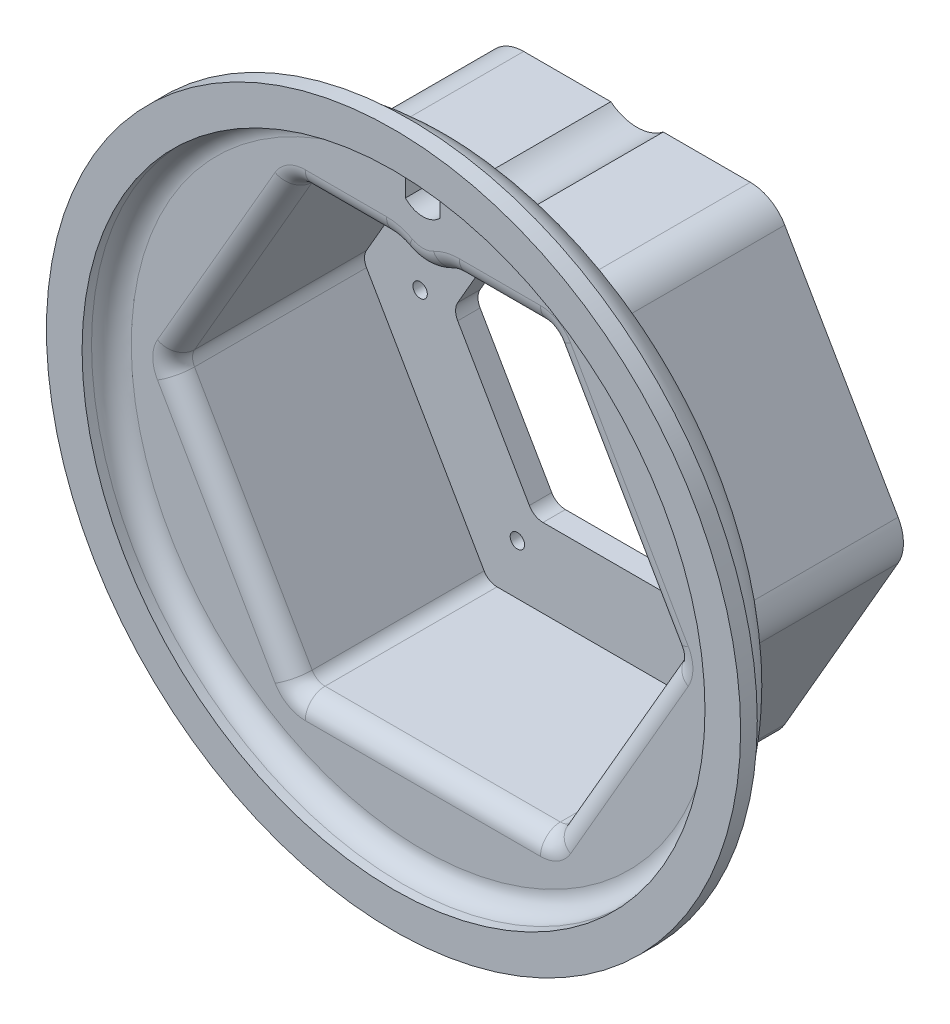
from build123d import *

# Parameters (mm, degrees)
BOSS_EXTRUDE1_DEPTH = 65
BOSS_EXTRUDE2_START = 9
BOSS_EXTRUDE2_DEPTH = 9
SKETCH6_R           = 132.3
BOSS_EXTRUDE3_DEPTH = 12.2
CUT_EXTRUDE1_REACH  = 204.402
SKETCH3_R           = 2.9
FILLET1_R           = 6.35
FILLET2_R           = 6
FILLET3_R           = 14
FILLET6_R           = 14
SKETCH12_R          = 131.85493252
SKETCH12_R_2        = 125.35493252
BOSS_EXTRUDE5_DEPTH = 5.1
SKETCH13_R          = 139.7
SKETCH13_R_2        = 125.35493252
BOSS_EXTRUDE7_DEPTH = 6.7
FILLET7_R           = 8
FILLET8_R           = 4
FILLET9_R           = 8
CUT_EXTRUDE2_DEPTH  = 211.969618666
CIRPATTERN1_COUNT   = 6
FILLET11_R          = 16
FILLET10_R          = 4


with BuildPart() as part:
    # Sketch1 → Boss-Extrude1 (new body)
    with BuildSketch(Plane.XY):
        with BuildLine():
            Line((109.696551146, 0), (54.848275573, 95))
            Line((54.848275573, 95), (10.560528181, 95))
            ThreePointArc((10.560528181, 95), (0, 91.321983506), (-10.560528181, 95))
            Line((-10.560528181, 95), (-54.848275573, 95))
            Line((-54.848275573, 95), (-109.696551146, 0))
            Line((-109.696551146, 0), (-54.848275573, -95))
            Line((-54.848275573, -95), (54.848275573, -95))
            Line((54.848275573, -95), (109.696551146, 0))
        make_face()
        with BuildLine():
            Line((101.613647377, 0), (50.806823689, 88))
            Line((50.806823689, 88), (10.560528181, 88))
            ThreePointArc((10.560528181, 88), (0, 84.321983506), (-10.560528181, 88))
            Line((-10.560528181, 88), (-50.806823689, 88))
            Line((-50.806823689, 88), (-101.613647377, 0))
            Line((-101.613647377, 0), (-50.806823689, -88))
            Line((-50.806823689, -88), (50.806823689, -88))
            Line((50.806823689, -88), (101.613647377, 0))
        make_face(mode=Mode.SUBTRACT)
    extrude(amount=BOSS_EXTRUDE1_DEPTH)

    # Sketch2 → Boss-Extrude2 (add)
    with BuildSketch(Plane(origin=(0, 0, 0), x_dir=(-1, 0, 0), z_dir=(0, 0, -1)).offset(BOSS_EXTRUDE2_START)):
        with BuildLine():
            Line((109.696551146, 0), (54.848275573, 95))
            Line((54.848275573, 95), (10.560528181, 95))
            ThreePointArc((10.560528181, 95), (0, 91.321983506), (-10.560528181, 95))
            Line((-10.560528181, 95), (-54.848275573, 95))
            Line((-54.848275573, 95), (-109.696551146, 0))
            Line((-109.696551146, 0), (-54.848275573, -95))
            Line((-54.848275573, -95), (54.848275573, -95))
            Line((54.848275573, -95), (109.696551146, 0))
        make_face()
        Polygon((65, 0), (32.5, 56.291651246), (-32.5, 56.291651246), (-65, 0), (-32.5, -56.291651246), (32.5, -56.291651246), align=None, mode=Mode.SUBTRACT)
    extrude(amount=-BOSS_EXTRUDE2_DEPTH)

    # Sketch6 → Boss-Extrude3 (add)
    with BuildSketch(Plane.XY.offset(65)):
        Circle(SKETCH6_R)
        with BuildLine():
            Line((101.613647377, 0), (50.806823689, 88))
            Line((50.806823689, 88), (10.560528181, 88))
            ThreePointArc((10.560528181, 88), (0, 84.321983506), (-10.560528181, 88))
            Line((-10.560528181, 88), (-50.806823689, 88))
            Line((-50.806823689, 88), (-101.613647377, 0))
            Line((-101.613647377, 0), (-50.806823689, -88))
            Line((-50.806823689, -88), (50.806823689, -88))
            Line((50.806823689, -88), (101.613647377, 0))
        make_face(mode=Mode.SUBTRACT)
    extrude(amount=BOSS_EXTRUDE3_DEPTH)

    # Sketch3 → Cut-Extrude1 (cut, up to next)
    with BuildSketch(Plane.XY, mode=Mode.PRIVATE) as cut_extrude1_sk1:
        with Locations((78.3, 0)):
            Circle(SKETCH3_R)
    cut_extrude1_tool1 = extrude(cut_extrude1_sk1.sketch, amount=-CUT_EXTRUDE1_REACH, mode=Mode.PRIVATE) & part.part
    cut_extrude1 = cut_extrude1_tool1.solids().sort_by_distance((78.3, 0, 0))[0]
    add(cut_extrude1, mode=Mode.SUBTRACT)

    # Fillet1
    fillet1_edges = [part.edges().sort_by_distance(p)[0] for p in [
        (-65, 0, -4.5),
        (-32.5, 56.291651246, -4.5),
        (32.5, 56.291651246, -4.5),
        (65, 0, -4.5),
        (32.5, -56.291651246, -4.5),
        (-32.5, -56.291651246, -4.5),
    ]]
    fillet(fillet1_edges, radius=FILLET1_R)

    # Fillet2
    fillet2_edges = [part.edges().sort_by_distance(p)[0] for p in [
        (50.806823689, -88, 38.6),
        (101.613647377, 0, 38.6),
        (50.806823689, 88, 38.6),
        (-50.806823689, 88, 38.6),
        (-101.613647377, 0, 38.6),
        (-50.806823689, -88, 38.6),
    ]]
    fillet(fillet2_edges, radius=FILLET2_R)

    # Fillet3
    fillet3_edges = [part.edges().sort_by_distance(p)[0] for p in [
        (10.560528181, 88, 38.6),
        (-10.560528181, 88, 38.6),
    ]]
    fillet(fillet3_edges, radius=FILLET3_R)

    # Fillet6
    # the kernel refuses this fillet: 14 mm, written as the material it takes off along each edge
    with BuildSketch(Plane(origin=(0, 0, 65), x_dir=(1, 0, 0), z_dir=(0, -1, 0))) as fillet6_piece_1:
        with BuildLine():
            CenterArc((118.416196487, 14), FILLET6_R, 270, 82.612951564)
            Line((118.416196487, 0), (118.416196487, -0.28))
            Line((118.416196487, -0.28), (132.3, -0.28))
            Line((132.3, -0.28), (132.58, 0))
            ThreePointArc((132.58, 0), (132.58, 6.1), (132.57767607, 12.164))
            Line((132.57767607, 12.164), (132.3, 12.2))
        make_face()
    revolve(axis=Axis((0, 0, 65), (0, 0, 1)), mode=Mode.SUBTRACT)

    # Sketch12 → Boss-Extrude5 (add)
    with BuildSketch(Plane.XY.offset(77.2)):
        Circle(SKETCH12_R)
        Circle(SKETCH12_R_2, mode=Mode.SUBTRACT)
    extrude(amount=BOSS_EXTRUDE5_DEPTH)

    # Sketch13 → Boss-Extrude7 (add)
    with BuildSketch(Plane.XY.offset(82.3)):
        Circle(SKETCH13_R)
        Circle(SKETCH13_R_2, mode=Mode.SUBTRACT)
    extrude(amount=BOSS_EXTRUDE7_DEPTH)

    # Fillet7
    fillet7_edges = [part.edges().sort_by_distance(p)[0] for p in [
        (-125.35493252, 0, 77.2),
    ]]
    fillet(fillet7_edges, radius=FILLET7_R)

    # Fillet8
    fillet8_edges = [part.edges().sort_by_distance(p)[0] for p in [
        (-131.85493252, 0, 82.3),
    ]]
    fillet(fillet8_edges, radius=FILLET8_R)

    # Fillet9
    fillet9_edges = [part.edges().sort_by_distance(p)[0] for p in [
        (-76.210235533, -44, 77.2),
        (0, -88, 77.2),
        (76.210235533, -44, 77.2),
        (76.210235533, 44, 77.2),
        (30.994427629, 88, 77.2),
        (-76.210235533, 44, 77.2),
        (-50.342722074, -87.196152423, 77.2),
        (50.342722074, -87.196152423, 77.2),
        (100.685444147, 0, 77.2),
        (50.342722074, 87.196152423, 77.2),
        (-50.342722074, 87.196152423, 77.2),
        (-100.685444147, 0, 77.2),
        (0, 84.321983506, 77.2),
        (-30.994427629, 88, 77.2),
        (11.236253723, 87.578391733, 77.2),
        (-11.236253723, 87.578391733, 77.2),
    ]]
    fillet(fillet9_edges, radius=FILLET9_R)

    # Sketch9 → Cut-Extrude2 (cut, through all)
    with BuildSketch(Plane(origin=(0, 0, 65), x_dir=(-1, 0, 0), z_dir=(0, 0, -1))):
        with BuildLine():
            Line((7, 106.321983506), (7, 119.321983506))
            ThreePointArc((7, 119.321983506), (0, 122.321983506), (-7, 119.321983506))
            Line((-7, 119.321983506), (-7, 106.321983506))
            ThreePointArc((-7, 106.321983506), (0, 103.321983506), (7, 106.321983506))
        make_face()
    extrude(amount=-CUT_EXTRUDE2_DEPTH, mode=Mode.SUBTRACT)

    # CirPattern1: Cut-Extrude1 ×6 about axis
    cirpattern1_axis = Axis((0, 0, 0), (0, 0, 1))
    for i in range(1, CIRPATTERN1_COUNT):
        add(cut_extrude1.rotate(cirpattern1_axis, i * 360 / CIRPATTERN1_COUNT), mode=Mode.SUBTRACT)

    # Fillet11
    fillet11_edges = [part.edges().sort_by_distance(p)[0] for p in [
        (54.848275573, -95, 28),
        (-54.848275573, -95, 28),
        (-109.696551146, 0, 28),
        (-54.848275573, 95, 28),
        (54.848275573, 95, 28),
        (109.696551146, 0, 28),
    ]]
    fillet(fillet11_edges, radius=FILLET11_R)

    # Fillet10
    fillet10_edges = [part.edges().sort_by_distance(p)[0] for p in [
        (0, 91.321983506, 65),
        (-28.085599723, 95, 65),
        (-82.27241336, -47.5, 65),
        (-82.27241336, 47.5, 65),
        (28.085599723, 95, 65),
        (82.27241336, 47.5, 65),
        (82.27241336, -47.5, 65),
        (0, -95, 65),
        (-107.221342532, 0, 65),
        (-53.610671266, 92.856406461, 65),
        (53.610671266, 92.856406461, 65),
        (107.221342532, 0, 65),
        (53.610671266, -92.856406461, 65),
        (-53.610671266, -92.856406461, 65),
    ]]
    fillet(fillet10_edges, radius=FILLET10_R)


solid = part.part
